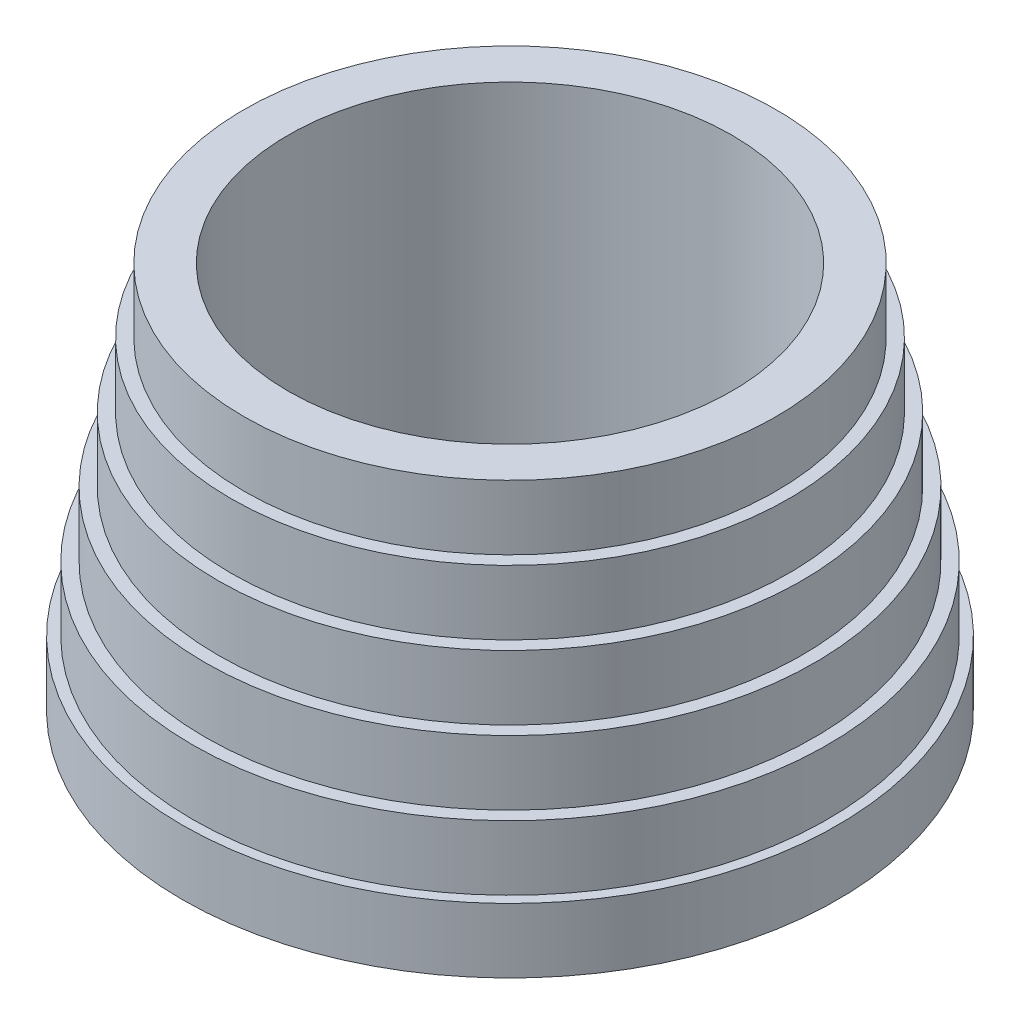
from build123d import *

# Parameters (mm, degrees)
SKETCH9_R           = 195.99424204
SKETCH9_R_2         = 171.779053358
BOSS_EXTRUDE1_DEPTH = 280.985470498
CHAMFER1_SIZE       = 10


with BuildPart() as part:
    # Sketch4 → Revolve3 (revolve)
    with BuildSketch(Plane.XY):
        Polygon((-253.775337615, -190), (-245.99424204, -190), (-245.99424204, -150), (-235.99424204, -150), (-235.99424204, -100), (-225.99424204, -100), (-225.99424204, -50), (-215.99424204, -50), (-215.99424204, 0), (-205.99424204, 0), (-205.99424204, 50), (-195.99424204, 50), (-195.99424204, 110), (-205.99424204, 110), (-205.99424204, 60), (-215.99424204, 60), (-215.99424204, 10), (-225.99424204, 10), (-225.99424204, -40), (-235.99424204, -40), (-235.99424204, -90), (-245.99424204, -90), (-245.99424204, -140), (-253.775337615, -140), align=None)
    revolve(axis=Axis((0, 105.494376543, 0), (0, -1, 0)))

    # Sketch9 → Boss-Extrude1 (add)
    with BuildSketch(Plane(origin=(0, 110, 0), x_dir=(1, 0, 0), z_dir=(0, 1, 0))):
        Circle(SKETCH9_R)
        Circle(SKETCH9_R_2, mode=Mode.SUBTRACT)
    extrude(amount=-BOSS_EXTRUDE1_DEPTH)

    # Chamfer1
    chamfer1_edges = [part.edges().sort_by_distance(p)[0] for p in [
        (-195.99424204, -170.985470498, 0),
    ]]
    chamfer(chamfer1_edges, length=CHAMFER1_SIZE)


solid = part.part
